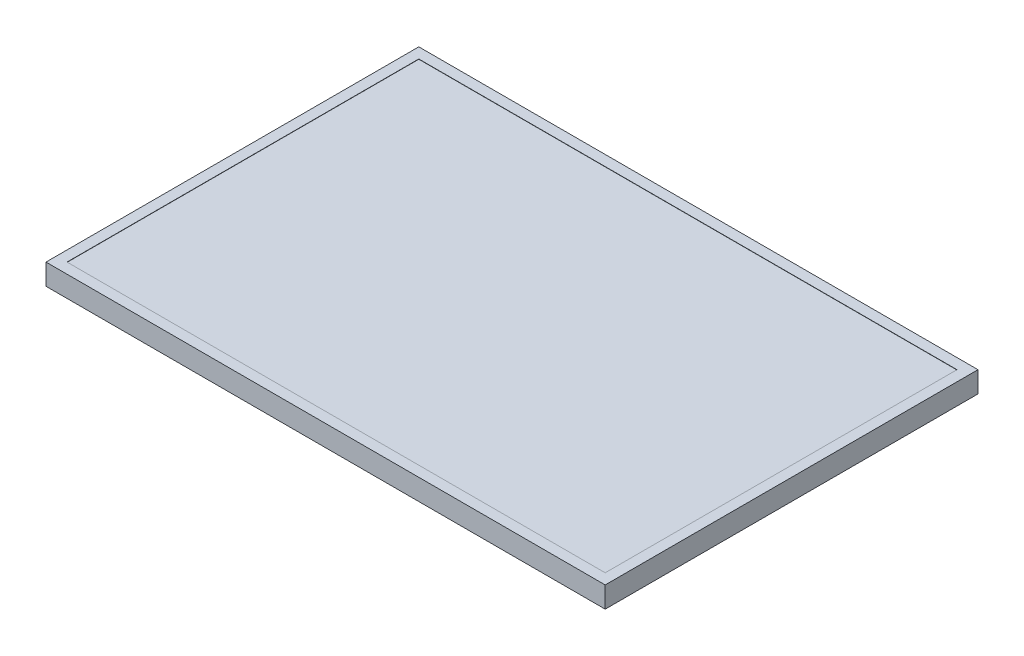
from build123d import *

# Parameters (mm, degrees)
SKETCH1_W                = 1025
SKETCH1_H                = 670
BOSS_EXTRUDE1_DEPTH      = 15
BOSS_EXTRUDE2_DEPTH      = 0.5
BOSS_EXTRUDE2_2_DEPTH    = 0.5
BOSS_EXTRUDE2_3_DEPTH    = 0.5
BOSS_EXTRUDE2_4_DEPTH    = 0.5
BOSS_EXTRUDE2_5_DEPTH    = 0.5
BOSS_EXTRUDE2_6_DEPTH    = 0.5
BOSS_EXTRUDE2_7_DEPTH    = 0.5
BOSS_EXTRUDE2_8_DEPTH    = 0.5
BOSS_EXTRUDE2_9_DEPTH    = 0.5
BOSS_EXTRUDE2_10_DEPTH   = 0.5
BOSS_EXTRUDE2_11_DEPTH   = 0.5
BOSS_EXTRUDE2_12_DEPTH   = 0.5
BOSS_EXTRUDE2_13_DEPTH   = 0.5
BOSS_EXTRUDE2_14_DEPTH   = 0.5
BOSS_EXTRUDE2_15_DEPTH   = 0.5
BOSS_EXTRUDE2_16_DEPTH   = 0.5
BOSS_EXTRUDE2_17_DEPTH   = 0.5
BOSS_EXTRUDE2_18_DEPTH   = 0.5
BOSS_EXTRUDE2_19_DEPTH   = 0.5
BOSS_EXTRUDE2_20_DEPTH   = 0.5
BOSS_EXTRUDE2_21_DEPTH   = 0.5
BOSS_EXTRUDE2_22_DEPTH   = 0.5
BOSS_EXTRUDE2_23_DEPTH   = 0.5
BOSS_EXTRUDE2_24_DEPTH   = 0.5
SKETCH3_W                = 1
SKETCH3_H                = 156
BOSS_EXTRUDE3_DEPTH      = 0.5
BOSS_EXTRUDE3_2_DEPTH    = 0.5
BOSS_EXTRUDE3_3_DEPTH    = 0.5
BOSS_EXTRUDE3_4_DEPTH    = 0.5
BOSS_EXTRUDE3_5_DEPTH    = 0.5
BOSS_EXTRUDE3_6_DEPTH    = 0.5
BOSS_EXTRUDE3_7_DEPTH    = 0.5
BOSS_EXTRUDE3_8_DEPTH    = 0.5
BOSS_EXTRUDE3_9_DEPTH    = 0.5
BOSS_EXTRUDE3_10_DEPTH   = 0.5
BOSS_EXTRUDE3_11_DEPTH   = 0.5
BOSS_EXTRUDE3_12_DEPTH   = 0.5
LPATTERN1_COUNT          = 6
LPATTERN1_PITCH          = 160
LPATTERN1_COUNT_DIR2     = 4
LPATTERN1_PITCH_DIR2     = 160
SKETCH4_W                = 979
SKETCH4_H                = 5
BOSS_EXTRUDE4_DEPTH      = 0.5
BOSS_EXTRUDE4_2_DEPTH    = 0.5
LPATTERN2_COUNT          = 4
LPATTERN2_PITCH          = 160
SKETCH5_W                = 14
SKETCH5_H                = 648
BOSS_EXTRUDE5_DEPTH      = 1.5
SKETCH6_W                = 1025
SKETCH6_H                = 670
BOSS_EXTRUDE6_DEPTH      = 3
BOSS_EXTRUDE7_DEPTH      = 5
BOSS_EXTRUDE7_DEPTH_BACK = 35
SKETCH7_W                = 1065
SKETCH7_H                = 710
SKETCH7_W_2              = 1025
SKETCH7_H_2              = 670


with BuildPart() as part:
    # Sketch1 → Boss-Extrude1 (new body)
    with BuildSketch(Plane(origin=(0, 0, 0), x_dir=(1, 0, 0), z_dir=(0, 1, 0))):
        Rectangle(SKETCH1_W, SKETCH1_H)
    extrude(amount=BOSS_EXTRUDE1_DEPTH)



with BuildPart() as body_2:
    # Sketch2 → Boss-Extrude2 (new body)
    with BuildSketch(Plane(origin=(0, 15, 0), x_dir=(1, 0, 0), z_dir=(0, 1, 0))):
        Polygon((-468.5, 318), (-332.5, 318), (-322.5, 308), (-322.5, 172), (-332.5, 162), (-468.5, 162), (-478.5, 172), (-478.5, 308), align=None)
    extrude(amount=BOSS_EXTRUDE2_DEPTH)


with BuildPart() as body_3:
    # Sketch2 → Boss-Extrude2 2 (new body)
    with BuildSketch(Plane(origin=(0, 15, 0), x_dir=(1, 0, 0), z_dir=(0, 1, 0))):
        Polygon((-308.5, 318), (-172.5, 318), (-162.5, 308), (-162.5, 172), (-172.5, 162), (-308.5, 162), (-318.5, 172), (-318.5, 308), align=None)
    extrude(amount=BOSS_EXTRUDE2_2_DEPTH)


with BuildPart() as body_4:
    # Sketch2 → Boss-Extrude2 3 (new body)
    with BuildSketch(Plane(origin=(0, 15, 0), x_dir=(1, 0, 0), z_dir=(0, 1, 0))):
        Polygon((-148.5, 318), (-12.5, 318), (-2.5, 308), (-2.5, 172), (-12.5, 162), (-148.5, 162), (-158.5, 172), (-158.5, 308), align=None)
    extrude(amount=BOSS_EXTRUDE2_3_DEPTH)


with BuildPart() as body_5:
    # Sketch2 → Boss-Extrude2 4 (new body)
    with BuildSketch(Plane(origin=(0, 15, 0), x_dir=(1, 0, 0), z_dir=(0, 1, 0))):
        Polygon((11.5, 318), (147.5, 318), (157.5, 308), (157.5, 172), (147.5, 162), (11.5, 162), (1.5, 172), (1.5, 308), align=None)
    extrude(amount=BOSS_EXTRUDE2_4_DEPTH)


with BuildPart() as body_6:
    # Sketch2 → Boss-Extrude2 5 (new body)
    with BuildSketch(Plane(origin=(0, 15, 0), x_dir=(1, 0, 0), z_dir=(0, 1, 0))):
        Polygon((171.5, 318), (307.5, 318), (317.5, 308), (317.5, 172), (307.5, 162), (171.5, 162), (161.5, 172), (161.5, 308), align=None)
    extrude(amount=BOSS_EXTRUDE2_5_DEPTH)


with BuildPart() as body_7:
    # Sketch2 → Boss-Extrude2 6 (new body)
    with BuildSketch(Plane(origin=(0, 15, 0), x_dir=(1, 0, 0), z_dir=(0, 1, 0))):
        Polygon((331.5, 318), (467.5, 318), (477.5, 308), (477.5, 172), (467.5, 162), (331.5, 162), (321.5, 172), (321.5, 308), align=None)
    extrude(amount=BOSS_EXTRUDE2_6_DEPTH)


with BuildPart() as body_8:
    # Sketch2 → Boss-Extrude2 7 (new body)
    with BuildSketch(Plane(origin=(0, 15, 0), x_dir=(1, 0, 0), z_dir=(0, 1, 0))):
        Polygon((-308.5, 158), (-172.5, 158), (-162.5, 148), (-162.5, 12), (-172.5, 2), (-308.5, 2), (-318.5, 12), (-318.5, 148), align=None)
    extrude(amount=BOSS_EXTRUDE2_7_DEPTH)


with BuildPart() as body_9:
    # Sketch2 → Boss-Extrude2 8 (new body)
    with BuildSketch(Plane(origin=(0, 15, 0), x_dir=(1, 0, 0), z_dir=(0, 1, 0))):
        Polygon((-148.5, 158), (-12.5, 158), (-2.5, 148), (-2.5, 12), (-12.5, 2), (-148.5, 2), (-158.5, 12), (-158.5, 148), align=None)
    extrude(amount=BOSS_EXTRUDE2_8_DEPTH)


with BuildPart() as body_10:
    # Sketch2 → Boss-Extrude2 9 (new body)
    with BuildSketch(Plane(origin=(0, 15, 0), x_dir=(1, 0, 0), z_dir=(0, 1, 0))):
        Polygon((11.5, 158), (147.5, 158), (157.5, 148), (157.5, 12), (147.5, 2), (11.5, 2), (1.5, 12), (1.5, 148), align=None)
    extrude(amount=BOSS_EXTRUDE2_9_DEPTH)


with BuildPart() as body_11:
    # Sketch2 → Boss-Extrude2 10 (new body)
    with BuildSketch(Plane(origin=(0, 15, 0), x_dir=(1, 0, 0), z_dir=(0, 1, 0))):
        Polygon((171.5, 158), (307.5, 158), (317.5, 148), (317.5, 12), (307.5, 2), (171.5, 2), (161.5, 12), (161.5, 148), align=None)
    extrude(amount=BOSS_EXTRUDE2_10_DEPTH)


with BuildPart() as body_12:
    # Sketch2 → Boss-Extrude2 11 (new body)
    with BuildSketch(Plane(origin=(0, 15, 0), x_dir=(1, 0, 0), z_dir=(0, 1, 0))):
        Polygon((331.5, 158), (467.5, 158), (477.5, 148), (477.5, 12), (467.5, 2), (331.5, 2), (321.5, 12), (321.5, 148), align=None)
    extrude(amount=BOSS_EXTRUDE2_11_DEPTH)


with BuildPart() as body_13:
    # Sketch2 → Boss-Extrude2 12 (new body)
    with BuildSketch(Plane(origin=(0, 15, 0), x_dir=(1, 0, 0), z_dir=(0, 1, 0))):
        Polygon((-308.5, -2), (-172.5, -2), (-162.5, -12), (-162.5, -148), (-172.5, -158), (-308.5, -158), (-318.5, -148), (-318.5, -12), align=None)
    extrude(amount=BOSS_EXTRUDE2_12_DEPTH)


with BuildPart() as body_14:
    # Sketch2 → Boss-Extrude2 13 (new body)
    with BuildSketch(Plane(origin=(0, 15, 0), x_dir=(1, 0, 0), z_dir=(0, 1, 0))):
        Polygon((-148.5, -2), (-12.5, -2), (-2.5, -12), (-2.5, -148), (-12.5, -158), (-148.5, -158), (-158.5, -148), (-158.5, -12), align=None)
    extrude(amount=BOSS_EXTRUDE2_13_DEPTH)


with BuildPart() as body_15:
    # Sketch2 → Boss-Extrude2 14 (new body)
    with BuildSketch(Plane(origin=(0, 15, 0), x_dir=(1, 0, 0), z_dir=(0, 1, 0))):
        Polygon((11.5, -2), (147.5, -2), (157.5, -12), (157.5, -148), (147.5, -158), (11.5, -158), (1.5, -148), (1.5, -12), align=None)
    extrude(amount=BOSS_EXTRUDE2_14_DEPTH)


with BuildPart() as body_16:
    # Sketch2 → Boss-Extrude2 15 (new body)
    with BuildSketch(Plane(origin=(0, 15, 0), x_dir=(1, 0, 0), z_dir=(0, 1, 0))):
        Polygon((171.5, -2), (307.5, -2), (317.5, -12), (317.5, -148), (307.5, -158), (171.5, -158), (161.5, -148), (161.5, -12), align=None)
    extrude(amount=BOSS_EXTRUDE2_15_DEPTH)


with BuildPart() as body_17:
    # Sketch2 → Boss-Extrude2 16 (new body)
    with BuildSketch(Plane(origin=(0, 15, 0), x_dir=(1, 0, 0), z_dir=(0, 1, 0))):
        Polygon((331.5, -2), (467.5, -2), (477.5, -12), (477.5, -148), (467.5, -158), (331.5, -158), (321.5, -148), (321.5, -12), align=None)
    extrude(amount=BOSS_EXTRUDE2_16_DEPTH)


with BuildPart() as body_18:
    # Sketch2 → Boss-Extrude2 17 (new body)
    with BuildSketch(Plane(origin=(0, 15, 0), x_dir=(1, 0, 0), z_dir=(0, 1, 0))):
        Polygon((-308.5, -162), (-172.5, -162), (-162.5, -172), (-162.5, -308), (-172.5, -318), (-308.5, -318), (-318.5, -308), (-318.5, -172), align=None)
    extrude(amount=BOSS_EXTRUDE2_17_DEPTH)


with BuildPart() as body_19:
    # Sketch2 → Boss-Extrude2 18 (new body)
    with BuildSketch(Plane(origin=(0, 15, 0), x_dir=(1, 0, 0), z_dir=(0, 1, 0))):
        Polygon((-148.5, -162), (-12.5, -162), (-2.5, -172), (-2.5, -308), (-12.5, -318), (-148.5, -318), (-158.5, -308), (-158.5, -172), align=None)
    extrude(amount=BOSS_EXTRUDE2_18_DEPTH)


with BuildPart() as body_20:
    # Sketch2 → Boss-Extrude2 19 (new body)
    with BuildSketch(Plane(origin=(0, 15, 0), x_dir=(1, 0, 0), z_dir=(0, 1, 0))):
        Polygon((11.5, -162), (147.5, -162), (157.5, -172), (157.5, -308), (147.5, -318), (11.5, -318), (1.5, -308), (1.5, -172), align=None)
    extrude(amount=BOSS_EXTRUDE2_19_DEPTH)


with BuildPart() as body_21:
    # Sketch2 → Boss-Extrude2 20 (new body)
    with BuildSketch(Plane(origin=(0, 15, 0), x_dir=(1, 0, 0), z_dir=(0, 1, 0))):
        Polygon((171.5, -162), (307.5, -162), (317.5, -172), (317.5, -308), (307.5, -318), (171.5, -318), (161.5, -308), (161.5, -172), align=None)
    extrude(amount=BOSS_EXTRUDE2_20_DEPTH)


with BuildPart() as body_22:
    # Sketch2 → Boss-Extrude2 21 (new body)
    with BuildSketch(Plane(origin=(0, 15, 0), x_dir=(1, 0, 0), z_dir=(0, 1, 0))):
        Polygon((331.5, -162), (467.5, -162), (477.5, -172), (477.5, -308), (467.5, -318), (331.5, -318), (321.5, -308), (321.5, -172), align=None)
    extrude(amount=BOSS_EXTRUDE2_21_DEPTH)


with BuildPart() as body_23:
    # Sketch2 → Boss-Extrude2 22 (new body)
    with BuildSketch(Plane(origin=(0, 15, 0), x_dir=(1, 0, 0), z_dir=(0, 1, 0))):
        Polygon((-468.5, 158), (-332.5, 158), (-322.5, 148), (-322.5, 12), (-332.5, 2), (-468.5, 2), (-478.5, 12), (-478.5, 148), align=None)
    extrude(amount=BOSS_EXTRUDE2_22_DEPTH)


with BuildPart() as body_24:
    # Sketch2 → Boss-Extrude2 23 (new body)
    with BuildSketch(Plane(origin=(0, 15, 0), x_dir=(1, 0, 0), z_dir=(0, 1, 0))):
        Polygon((-468.5, -2), (-332.5, -2), (-322.5, -12), (-322.5, -148), (-332.5, -158), (-468.5, -158), (-478.5, -148), (-478.5, -12), align=None)
    extrude(amount=BOSS_EXTRUDE2_23_DEPTH)


with BuildPart() as body_25:
    # Sketch2 → Boss-Extrude2 24 (new body)
    with BuildSketch(Plane(origin=(0, 15, 0), x_dir=(1, 0, 0), z_dir=(0, 1, 0))):
        Polygon((-468.5, -162), (-332.5, -162), (-322.5, -172), (-322.5, -308), (-332.5, -318), (-468.5, -318), (-478.5, -308), (-478.5, -172), align=None)
    extrude(amount=BOSS_EXTRUDE2_24_DEPTH)


with BuildPart() as body_26:
    # Sketch3 → Boss-Extrude3 (new body)
    with BuildSketch(Plane(origin=(0, 15.5, 0), x_dir=(1, 0, 0), z_dir=(0, 1, 0))):
        with Locations((-456, 240)):
            Rectangle(SKETCH3_W, SKETCH3_H)
    boss_extrude3 = extrude(amount=BOSS_EXTRUDE3_DEPTH)


with BuildPart() as body_27:
    # Sketch3 → Boss-Extrude3 2 (new body)
    with BuildSketch(Plane(origin=(0, 15.5, 0), x_dir=(1, 0, 0), z_dir=(0, 1, 0))):
        with Locations((-446, 240)):
            Rectangle(SKETCH3_W, SKETCH3_H)
    boss_extrude3_2 = extrude(amount=BOSS_EXTRUDE3_2_DEPTH)


with BuildPart() as body_28:
    # Sketch3 → Boss-Extrude3 3 (new body)
    with BuildSketch(Plane(origin=(0, 15.5, 0), x_dir=(1, 0, 0), z_dir=(0, 1, 0))):
        with Locations((-436, 240)):
            Rectangle(SKETCH3_W, SKETCH3_H)
    boss_extrude3_3 = extrude(amount=BOSS_EXTRUDE3_3_DEPTH)


with BuildPart() as body_29:
    # Sketch3 → Boss-Extrude3 4 (new body)
    with BuildSketch(Plane(origin=(0, 15.5, 0), x_dir=(1, 0, 0), z_dir=(0, 1, 0))):
        with Locations((-426, 240)):
            Rectangle(SKETCH3_W, SKETCH3_H)
    boss_extrude3_4 = extrude(amount=BOSS_EXTRUDE3_4_DEPTH)


with BuildPart() as body_30:
    # Sketch3 → Boss-Extrude3 5 (new body)
    with BuildSketch(Plane(origin=(0, 15.5, 0), x_dir=(1, 0, 0), z_dir=(0, 1, 0))):
        with Locations((-416, 240)):
            Rectangle(SKETCH3_W, SKETCH3_H)
    boss_extrude3_5 = extrude(amount=BOSS_EXTRUDE3_5_DEPTH)


with BuildPart() as body_31:
    # Sketch3 → Boss-Extrude3 6 (new body)
    with BuildSketch(Plane(origin=(0, 15.5, 0), x_dir=(1, 0, 0), z_dir=(0, 1, 0))):
        with Locations((-406, 240)):
            Rectangle(SKETCH3_W, SKETCH3_H)
    boss_extrude3_6 = extrude(amount=BOSS_EXTRUDE3_6_DEPTH)


with BuildPart() as body_32:
    # Sketch3 → Boss-Extrude3 7 (new body)
    with BuildSketch(Plane(origin=(0, 15.5, 0), x_dir=(1, 0, 0), z_dir=(0, 1, 0))):
        with Locations((-396, 240)):
            Rectangle(SKETCH3_W, SKETCH3_H)
    boss_extrude3_7 = extrude(amount=BOSS_EXTRUDE3_7_DEPTH)


with BuildPart() as body_33:
    # Sketch3 → Boss-Extrude3 8 (new body)
    with BuildSketch(Plane(origin=(0, 15.5, 0), x_dir=(1, 0, 0), z_dir=(0, 1, 0))):
        with Locations((-386, 240)):
            Rectangle(SKETCH3_W, SKETCH3_H)
    boss_extrude3_8 = extrude(amount=BOSS_EXTRUDE3_8_DEPTH)


with BuildPart() as body_34:
    # Sketch3 → Boss-Extrude3 9 (new body)
    with BuildSketch(Plane(origin=(0, 15.5, 0), x_dir=(1, 0, 0), z_dir=(0, 1, 0))):
        with Locations((-376, 240)):
            Rectangle(SKETCH3_W, SKETCH3_H)
    boss_extrude3_9 = extrude(amount=BOSS_EXTRUDE3_9_DEPTH)


with BuildPart() as body_35:
    # Sketch3 → Boss-Extrude3 10 (new body)
    with BuildSketch(Plane(origin=(0, 15.5, 0), x_dir=(1, 0, 0), z_dir=(0, 1, 0))):
        with Locations((-366, 240)):
            Rectangle(SKETCH3_W, SKETCH3_H)
    boss_extrude3_10 = extrude(amount=BOSS_EXTRUDE3_10_DEPTH)


with BuildPart() as body_36:
    # Sketch3 → Boss-Extrude3 11 (new body)
    with BuildSketch(Plane(origin=(0, 15.5, 0), x_dir=(1, 0, 0), z_dir=(0, 1, 0))):
        with Locations((-356, 240)):
            Rectangle(SKETCH3_W, SKETCH3_H)
    boss_extrude3_11 = extrude(amount=BOSS_EXTRUDE3_11_DEPTH)


with BuildPart() as body_37:
    # Sketch3 → Boss-Extrude3 12 (new body)
    with BuildSketch(Plane(origin=(0, 15.5, 0), x_dir=(1, 0, 0), z_dir=(0, 1, 0))):
        with Locations((-346, 240)):
            Rectangle(SKETCH3_W, SKETCH3_H)
    boss_extrude3_12 = extrude(amount=BOSS_EXTRUDE3_12_DEPTH)


with BuildPart() as lpattern1_1:
    # LPattern1: Boss-Extrude3, Boss-Extrude3 2, Boss-Extrude3 3, Boss-Extrude3 4, Boss-Extrude3 5, Boss-Extrude3 6, Boss-Extrude3 7, Boss-Extrude3 8, Boss-Extrude3 9, Boss-Extrude3 10, Boss-Extrude3 11, Boss-Extrude3 12 6 × 4
    with Locations(*[(i * LPATTERN1_PITCH, 0, j * LPATTERN1_PITCH_DIR2) for i in range(LPATTERN1_COUNT) for j in range(LPATTERN1_COUNT_DIR2) if (i, j) != (0, 0)]):
        add(boss_extrude3)
        add(boss_extrude3_2)
        add(boss_extrude3_3)
        add(boss_extrude3_4)
        add(boss_extrude3_5)
        add(boss_extrude3_6)
        add(boss_extrude3_7)
        add(boss_extrude3_8)
        add(boss_extrude3_9)
        add(boss_extrude3_10)
        add(boss_extrude3_11)
        add(boss_extrude3_12)


with BuildPart() as body_314:
    # Sketch4 → Boss-Extrude4 (new body)
    with BuildSketch(Plane(origin=(0, 16, 0), x_dir=(1, 0, 0), z_dir=(0, 1, 0))):
        with Locations((11, 278.5)):
            Rectangle(SKETCH4_W, SKETCH4_H)
    boss_extrude4 = extrude(amount=BOSS_EXTRUDE4_DEPTH)


with BuildPart() as body_315:
    # Sketch4 → Boss-Extrude4 2 (new body)
    with BuildSketch(Plane(origin=(0, 16, 0), x_dir=(1, 0, 0), z_dir=(0, 1, 0))):
        with Locations((11, 198.5)):
            Rectangle(SKETCH4_W, SKETCH4_H)
    boss_extrude4_2 = extrude(amount=BOSS_EXTRUDE4_2_DEPTH)


with BuildPart() as lpattern2_1:
    # LPattern2: pattern copy
    add(boss_extrude4.moved(Location(Vector(0, 0, 1) * (1 * LPATTERN2_PITCH))))


with BuildPart() as lpattern2_2:
    # LPattern2: pattern copy
    add(boss_extrude4.moved(Location(Vector(0, 0, 1) * (2 * LPATTERN2_PITCH))))


with BuildPart() as lpattern2_3:
    # LPattern2: pattern copy
    add(boss_extrude4.moved(Location(Vector(0, 0, 1) * (3 * LPATTERN2_PITCH))))


with BuildPart() as lpattern2_4:
    # LPattern2: pattern copy
    add(boss_extrude4_2.moved(Location(Vector(0, 0, 1) * (1 * LPATTERN2_PITCH))))


with BuildPart() as lpattern2_5:
    # LPattern2: pattern copy
    add(boss_extrude4_2.moved(Location(Vector(0, 0, 1) * (2 * LPATTERN2_PITCH))))


with BuildPart() as lpattern2_6:
    # LPattern2: pattern copy
    add(boss_extrude4_2.moved(Location(Vector(0, 0, 1) * (3 * LPATTERN2_PITCH))))


with BuildPart() as part_1:
    add(part.part)

    add(body_314.part)  # Boss-Extrude5 merges body 314

    add(body_315.part)  # Boss-Extrude5 merges body 315

    add(lpattern2_1.part)  # Boss-Extrude5 merges LPattern2_1

    add(lpattern2_2.part)  # Boss-Extrude5 merges LPattern2_2

    add(lpattern2_3.part)  # Boss-Extrude5 merges LPattern2_3

    add(lpattern2_4.part)  # Boss-Extrude5 merges LPattern2_4

    add(lpattern2_5.part)  # Boss-Extrude5 merges LPattern2_5

    add(lpattern2_6.part)  # Boss-Extrude5 merges LPattern2_6
    # Sketch5 → Boss-Extrude5 (add)
    with BuildSketch(Plane(origin=(0, 15, 0), x_dir=(1, 0, 0), z_dir=(0, 1, 0))):
        with Locations((493.5, 0)):
            Rectangle(SKETCH5_W, SKETCH5_H)
    extrude(amount=BOSS_EXTRUDE5_DEPTH)


with BuildPart() as body_314_2:
    # Sketch6 → Boss-Extrude6 (new body)
    with BuildSketch(Plane(origin=(0, 16.5, 0), x_dir=(1, 0, 0), z_dir=(0, 1, 0))):
        Rectangle(SKETCH6_W, SKETCH6_H)
    extrude(amount=BOSS_EXTRUDE6_DEPTH)


with BuildPart() as body_315_2:
    # Sketch7 → Boss-Extrude7 (new, two sides: drawn at the far end of the back side and taken through both)
    with BuildSketch(Plane(origin=(0, 15, 0), x_dir=(1, 0, 0), z_dir=(0, 1, 0)).offset(-BOSS_EXTRUDE7_DEPTH_BACK)):
        Rectangle(SKETCH7_W, SKETCH7_H)
        Rectangle(SKETCH7_W_2, SKETCH7_H_2, mode=Mode.SUBTRACT)
    extrude(amount=BOSS_EXTRUDE7_DEPTH + BOSS_EXTRUDE7_DEPTH_BACK)


solid = Compound([body_2.part, body_3.part, body_4.part, body_5.part, body_6.part, body_7.part, body_8.part, body_9.part, body_10.part, body_11.part, body_12.part, body_13.part, body_14.part, body_15.part, body_16.part, body_17.part, body_18.part, body_19.part, body_20.part, body_21.part, body_22.part, body_23.part, body_24.part, body_25.part, body_26.part, body_27.part, body_28.part, body_29.part, body_30.part, body_31.part, body_32.part, body_33.part, body_34.part, body_35.part, body_36.part, body_37.part, lpattern1_1.part, part_1.part, body_314_2.part, body_315_2.part])
